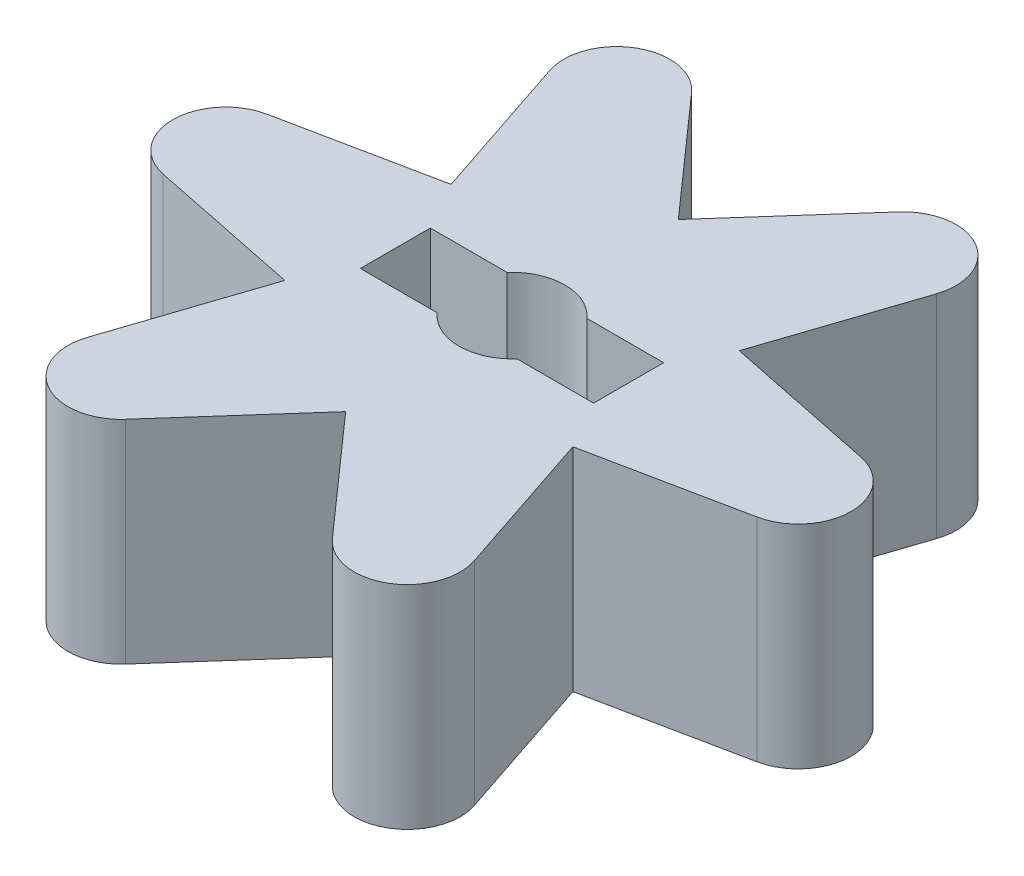
from build123d import *

# Parameters (mm, degrees)
BOSS_EXTRUDE1_DEPTH = 10
CUT_EXTRUDE1_DEPTH  = 6
SKETCH3_R           = 6
CUT_EXTRUDE2_DEPTH  = 2
CHAMFER1_SIZE       = 2


with BuildPart() as part:
    # Sketch1 → Boss-Extrude1 (new body)
    with BuildSketch(Plane(origin=(0, 0, 0), x_dir=(1, 0, 0), z_dir=(0, 1, 0))):
        with BuildLine():
            ThreePointArc((4.87913418, -13.349613461), (8, -13.856406461), (9.121537298, -10.900260879))
            Line((9.121537298, -10.900260879), (6.793934197, -3.922479738))
            Line((6.793934197, -3.922479738), (14.000671478, -2.449352582))
            ThreePointArc((14.000671478, -2.449352582), (16, 0), (14.000671478, 2.449352582))
            Line((14.000671478, 2.449352582), (6.793934197, 3.922479738))
            Line((6.793934197, 3.922479738), (9.121537298, 10.900260879))
            ThreePointArc((9.121537298, 10.900260879), (8, 13.856406461), (4.87913418, 13.349613461))
            Line((4.87913418, 13.349613461), (0, 7.844959475))
            Line((0, 7.844959475), (-4.87913418, 13.349613461))
            ThreePointArc((-4.87913418, 13.349613461), (-8, 13.856406461), (-9.121537298, 10.900260879))
            Line((-9.121537298, 10.900260879), (-6.793934197, 3.922479738))
            Line((-6.793934197, 3.922479738), (-14.000671478, 2.449352582))
            ThreePointArc((-14.000671478, 2.449352582), (-16, 0), (-14.000671478, -2.449352582))
            Line((-14.000671478, -2.449352582), (-6.793934197, -3.922479738))
            Line((-6.793934197, -3.922479738), (-9.121537298, -10.900260879))
            ThreePointArc((-9.121537298, -10.900260879), (-8, -13.856406461), (-4.87913418, -13.349613461))
            Line((-4.87913418, -13.349613461), (0, -7.844959475))
            Line((0, -7.844959475), (4.87913418, -13.349613461))
        make_face()
    extrude(amount=BOSS_EXTRUDE1_DEPTH)

    # Sketch2 → Cut-Extrude1 (cut)
    # profile 1 of 2: a face of its own
    with BuildSketch(Plane(origin=(0, 10, 0), x_dir=(1, 0, 0), z_dir=(0, 1, 0))):
        with BuildLine():
            Line((-1.878163997, -1.65), (-5.5, -1.65))
            Line((-5.5, -1.65), (-5.5, 1.65))
            Line((-5.5, 1.65), (-1.878163997, 1.65))
            ThreePointArc((-1.878163997, 1.65), (0, 2.5), (1.878163997, 1.65))
            Line((1.878163997, 1.65), (5.5, 1.65))
            Line((5.5, 1.65), (5.5, -1.65))
            Line((5.5, -1.65), (1.878163997, -1.65))
            ThreePointArc((1.878163997, -1.65), (0, -2.5), (-1.878163997, -1.65))
        make_face()
        with BuildLine():
            ThreePointArc((1.809005252, 1.5), (0, 2.35), (-1.809005252, 1.5))
            Line((-1.809005252, 1.5), (-5.35, 1.5))
            Line((-5.35, 1.5), (-5.35, -1.5))
            Line((-5.35, -1.5), (-1.809005252, -1.5))
            ThreePointArc((-1.809005252, -1.5), (0, -2.35), (1.809005252, -1.5))
            Line((1.809005252, -1.5), (5.35, -1.5))
            Line((5.35, -1.5), (5.35, 1.5))
            Line((5.35, 1.5), (1.809005252, 1.5))
        make_face(mode=Mode.SUBTRACT)
    # profile 2 of 2: a face of its own
    with BuildSketch(Plane(origin=(0, 10, 0), x_dir=(1, 0, 0), z_dir=(0, 1, 0))):
        with BuildLine():
            Line((5.35, 1.5), (1.809005252, 1.5))
            ThreePointArc((1.809005252, 1.5), (0, 2.35), (-1.809005252, 1.5))
            Line((-1.809005252, 1.5), (-5.35, 1.5))
            Line((-5.35, 1.5), (-5.35, -1.5))
            Line((-5.35, -1.5), (-1.809005252, -1.5))
            ThreePointArc((-1.809005252, -1.5), (0, -2.35), (1.809005252, -1.5))
            Line((1.809005252, -1.5), (5.35, -1.5))
            Line((5.35, -1.5), (5.35, 1.5))
        make_face()
    extrude(amount=-CUT_EXTRUDE1_DEPTH, mode=Mode.SUBTRACT)

    # Sketch3 → Cut-Extrude2 (cut)
    with BuildSketch(Plane.XZ):
        with Locations(Location((0, 0, 0), (0, 0, 270))):
            Circle(SKETCH3_R)
    extrude(amount=-CUT_EXTRUDE2_DEPTH, mode=Mode.SUBTRACT)

    # Chamfer1
    chamfer1_edges = [part.edges().sort_by_distance(p)[0] for p in [
        (0, 2, 6),
    ]]
    chamfer(chamfer1_edges, length=CHAMFER1_SIZE - 0.0001)  # a hair under: the kernel refuses the full size


solid = part.part
